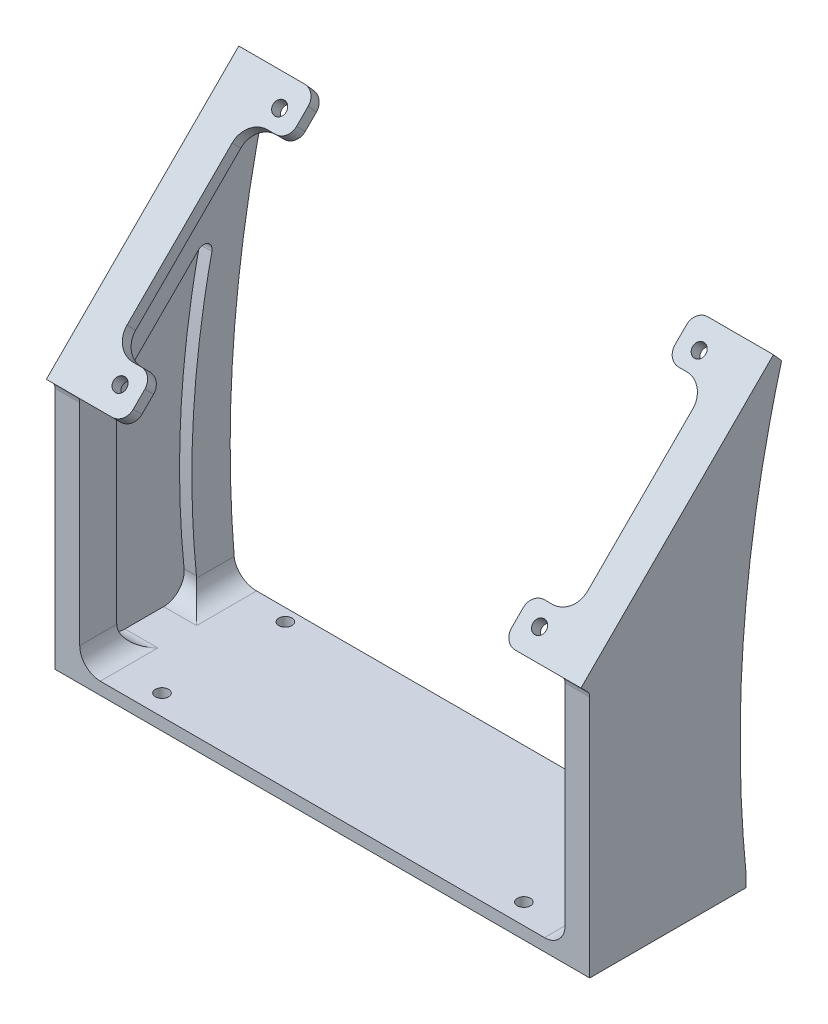
from build123d import *

# Parameters (mm, degrees)
SKETCH_1_W          = 20
SKETCH_1_H          = 38
SKETCH_1_R          = 1.6
EXTRUDE_1_DEPTH     = 3
SKETCH_7_W          = 38
SKETCH_7_H          = 3
EXTRUDE_7_DEPTH     = 6
EXTRUDE_8_DEPTH     = 19
FILLET_1_R          = 2
SKETCH_10_R         = 1.6
CUT_EXTRUDE_3_DEPTH = 10
CUT_EXTRUDE_4_DEPTH = 3
SKETCH_13_W         = 10
SKETCH_13_H         = 46.172897719
CUT_EXTRUDE_5_DEPTH = 3
FILLET_3_R          = 10
FILLET_4_R          = 5
FILLET_5_R          = 2
FILLET_6_R          = 5
FILLET_7_R          = 5
FILLET_8_R          = 3
SKETCH_11_W         = 39
SKETCH_11_H         = 38
EXTRUDE_9_DEPTH     = 3
FILLET_START        = -37.531780157
FILLET_9_DEPTH      = 9.135274029
FILLET_START_2      = -9
FILLET_9_2_DEPTH    = 9
FILLET_START_3      = -38.0000001
FILLET_9_3_DEPTH    = 14.603493972
FILLET_START_4      = -14
FILLET_9_4_DEPTH    = 5
FILLET_9_5_DEPTH    = 5


with BuildPart() as part:
    # 草图1 → 凸台-拉伸1 (new body)
    with BuildSketch(Plane(origin=(0, 0, 0), x_dir=(1, 0, 0), z_dir=(0, 1, 0))):
        with Locations((10, 19)):
            Rectangle(SKETCH_1_W, SKETCH_1_H)
        with Locations(Location((15, 5, 0), (0, 0, 270))):
            Circle(SKETCH_1_R, mode=Mode.SUBTRACT)
        with Locations(Location((15, 35, 0), (0, 0, 270))):
            Circle(SKETCH_1_R, mode=Mode.SUBTRACT)
    extrude(amount=EXTRUDE_1_DEPTH)

    # 草图7 → 凸台-拉伸7 (add)
    with BuildSketch(Plane.ZY):
        with BuildLine():
            Line((-38, 3), (0, 3))
            Line((0, 3), (0, 60))
            Line((0, 60), (-38, 60))
            add(Edge.make_bspline(
                [(-38, 3), (-35.160021148, 31.761534368), (-38, 60)],
                knots=[0, 0, 0, 0.545624852, 0.545624852, 0.545624852], degree=2))
        make_face()
        with Locations((-19, 1.5)):
            Rectangle(SKETCH_7_W, SKETCH_7_H)
        with BuildLine():
            Line((-38, 60), (0, 60))
            Line((0, 60), (2.121320344, 62.121320344))
            Line((2.121320344, 62.121320344), (-44.669984364, 108.912625051))
            Line((-44.669984364, 108.912625051), (-46.669047558, 106.669047558))
            add(Edge.make_bspline(
                [(-38, 60), (-40.365023894, 83.51589552), (-46.669047558, 106.669047558)],
                knots=[0.545624852, 0.545624852, 0.545624852, 1, 1, 1], degree=2))
        make_face()
    extrude(amount=EXTRUDE_7_DEPTH)

    # 草图8 → 凸台-拉伸8 (add)
    with BuildSketch(Plane.ZY.offset(6)):
        Polygon((-44.669984364, 108.912625051), (-46.669047558, 106.669047558), (0, 60), (2.121320344, 62.121320344), align=None)
    extrude(amount=-EXTRUDE_8_DEPTH)

    # 圆角1
    fillet_1_edges = [part.edges().sort_by_distance(p)[0] for p in [
        (-3, 60, 0),
    ]]
    fillet(fillet_1_edges, radius=FILLET_1_R)

    # 草图10 → 切除-拉伸3 (cut)
    with BuildSketch(Plane(origin=(0, 32.121320344, 32.121320344), x_dir=(1, 0, 0), z_dir=(0, 0.7071067811865476, 0.7071067811865475))):
        with Locations(Location((8, 102.866406871, 0), (0, 0, 270))):
            Circle(SKETCH_10_R)
        with Locations(Location((8, 47.986406871, 0), (0, 0, 270))):
            Circle(SKETCH_10_R)
    extrude(amount=-CUT_EXTRUDE_3_DEPTH, mode=Mode.SUBTRACT)

    # 草图12 → 切除-拉伸4 (cut)
    with BuildSketch(Plane(origin=(0, 0, 0), x_dir=(0, 0, -1), z_dir=(1, 0, 0))):
        with BuildLine():
            Line((9, 57), (9, 3))
            Line((9, 3), (29, 3))
            add(Edge.make_bspline(
                [(29, 3), (25.530992691, 30.329804849), (29, 57)],
                knots=[0, 0, 0, 0.681816387, 0.681816387, 0.681816387], degree=2))
            Line((29, 57), (9, 57))
        make_face()
        with BuildLine():
            Line((33.748737342, 81.748737342), (9, 57))
            Line((9, 57), (29, 57))
            add(Edge.make_bspline(
                [(29, 57), (30.618883469, 69.446194026), (33.748737342, 81.748737342)],
                knots=[0.681816387, 0.681816387, 0.681816387, 1, 1, 1], degree=2))
        make_face()
    extrude(amount=-CUT_EXTRUDE_4_DEPTH, mode=Mode.SUBTRACT)

    # 草图13 → 切除-拉伸5 (cut)
    with BuildSketch(Plane(origin=(0, 32.121320344, 32.121320344), x_dir=(1, 0, 0), z_dir=(0, 0.7071067811865476, 0.7071067811865475))):
        with Locations((8, 75.512855731)):
            Rectangle(SKETCH_13_W, SKETCH_13_H)
    extrude(amount=-CUT_EXTRUDE_5_DEPTH, mode=Mode.SUBTRACT)

    # 圆角3
    fillet_3_edges = [part.edges().sort_by_distance(p)[0] for p in [
        (-1.5, 57, -9),
    ]]
    fillet(fillet_3_edges, radius=FILLET_3_R)

    # 圆角4
    fillet_4_edges = [part.edges().sort_by_distance(p)[0] for p in [
        (-1.5, 3, -29),
        (-1.5, 3, -9),
    ]]
    fillet(fillet_4_edges, radius=FILLET_4_R)

    # 圆角5
    fillet_5_edges = [part.edges().sort_by_distance(p)[0] for p in [
        (-1.5, 81.748737342, -33.748737342),
    ]]
    fillet(fillet_5_edges, radius=FILLET_5_R)

    # 圆角6
    fillet_6_edges = [part.edges().sort_by_distance(p)[0] for p in [
        (3, 100.780897067, -38.659576724),
    ]]
    fillet(fillet_6_edges, radius=FILLET_6_R)

    # 圆角7
    fillet_7_edges = [part.edges().sort_by_distance(p)[0] for p in [
        (3, 68.131727984, -6.01040764),
    ]]
    fillet(fillet_7_edges, radius=FILLET_7_R)

    # 圆角8
    fillet_8_edges = [part.edges().sort_by_distance(p)[0] for p in [
        (13, 61.060660172, 1.060660172),
        (13, 107.790836305, -45.669515961),
        (13, 100.780897067, -38.659576724),
        (13, 68.131727984, -6.01040764),
    ]]
    fillet(fillet_8_edges, radius=FILLET_8_R)

    # 草图11 → 凸台-拉伸9 (add)
    with BuildSketch(Plane(origin=(0, 0, 0), x_dir=(1, 0, 0), z_dir=(0, 1, 0))):
        with Locations((39.5, 19)):
            Rectangle(SKETCH_11_W, SKETCH_11_H)
    extrude(amount=EXTRUDE_9_DEPTH)

    # 圆角9: read off the stored shape, not the designer's step
    # 圆角9 outline → 圆角9 (add)
    with BuildSketch(Plane.XY.offset(FILLET_START)):
        with BuildLine():
            Line((0, 3), (5, 3))
            ThreePointArc((5, 3), (1.464466094, 4.464466094), (0, 8))
            Line((0, 8), (0, 3))
        make_face()
    extrude(amount=FILLET_9_DEPTH)

    # Fillet 9 2 outline → Fillet 9 2 (add)
    with BuildSketch(Plane.XY.offset(FILLET_START_2)):
        with BuildLine():
            Line((0, 3), (5, 3))
            ThreePointArc((5, 3), (1.464466094, 4.464466094), (0, 8))
            Line((0, 8), (0, 3))
        make_face()
    extrude(amount=FILLET_9_2_DEPTH)

    # Fillet 9 3 outline → Fillet 9 3 (add)
    with BuildSketch(Plane.XY.offset(FILLET_START_3)):
        with BuildLine():
            Line((0, 3), (5, 3))
            ThreePointArc((5, 3), (1.464466094, 4.464466094), (0, 8))
            Line((0, 8), (0, 3))
        make_face()
    extrude(amount=FILLET_9_3_DEPTH)

    # Fillet 9 4 outline → Fillet 9 4 (add)
    with BuildSketch(Plane.XY.offset(FILLET_START_4)):
        with BuildLine():
            Line((0, 3), (5, 3))
            ThreePointArc((5, 3), (1.464466094, 4.464466094), (0, 8))
            Line((0, 8), (0, 3))
        make_face()
    extrude(amount=FILLET_9_4_DEPTH)

    # Fillet 9 5 outline → Fillet 9 5 (cut)
    with BuildSketch(Plane.YZ):
        with BuildLine():
            Line((3, -14), (8, -14))
            Line((8, -14), (8, -9))
            ThreePointArc((8, -9), (4.464466094, -10.464466094), (3, -14))
        make_face()
        with BuildLine():
            Line((8, -38.0000001), (8, -37.548880036))
            add(Edge.make_bspline(
                [(3, -38), (5.50197912, -37.752948932), (8, -37.548880036)],
                knots=[0, 0, 0, 0.047464157, 0.047464157, 0.047464157], degree=2))
            Line((3, -38), (8, -38.0000001))
        make_face()
        with BuildLine():
            ThreePointArc((3, -23.396506128), (4.464466094, -26.932040034), (8, -28.396506128))
            Line((8, -28.396506128), (8, -23.396506128))
            Line((8, -23.396506128), (3, -23.396506128))
        make_face()
    extrude(amount=FILLET_9_5_DEPTH, mode=Mode.SUBTRACT)

    # 镜向6: part across plane


with BuildPart() as part_1:
    add(part.part)
    add(part.part.mirror(Plane(origin=(59, 0, 0), x_dir=(0, 0, 1), z_dir=(1, 0, 0))))


solid = part_1.part
